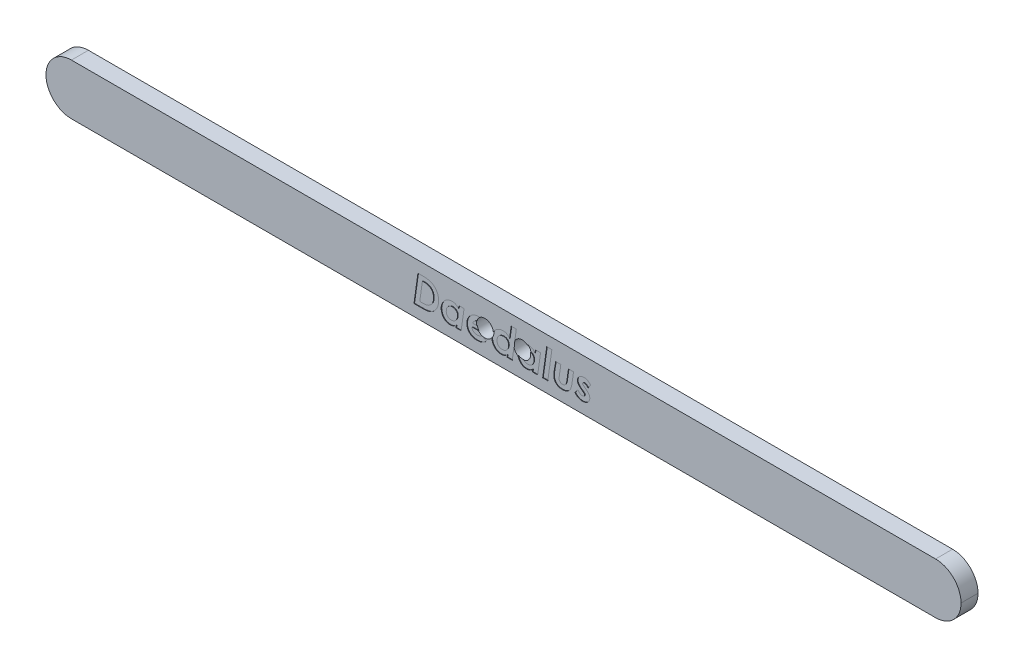
from build123d import *

# Parameters (mm, degrees)
SKETCH1_W           = 161.8
SKETCH1_H           = 9
SKETCH1_R           = 1.5
BOSS_EXTRUDE1_DEPTH = 1.5
FILLET1_R           = 4.5
CUT_EXTRUDE1_DEPTH  = 0.1


with BuildPart() as part:
    # Sketch1 → Boss-Extrude1 (new, symmetric)
    with BuildSketch(Plane.XY):
        Rectangle(SKETCH1_W, SKETCH1_H)
        with Locations((-3.3, 0)):
            Circle(SKETCH1_R, mode=Mode.SUBTRACT)
        with Locations(Location((3.3, 0, 0), (0, 0, 180))):
            Circle(SKETCH1_R, mode=Mode.SUBTRACT)
    extrude(amount=BOSS_EXTRUDE1_DEPTH, both=True)

    # Fillet1
    fillet1_edges = [part.edges().sort_by_distance(p)[0] for p in [
        (80.9, -4.5, 0),
        (80.9, 4.5, 0),
        (-80.9, -4.5, 0),
        (-80.9, 4.5, 0),
    ]]
    fillet(fillet1_edges, radius=FILLET1_R - 0.0001)  # a hair under: the kernel refuses the full size

    # Sketch2 → Cut-Extrude1 (cut)
    # profile 1 of 8: a face of its own
    with BuildSketch(Plane.XY.offset(1.5)):
        with BuildLine():
            Line((-15.132211538, 2.5), (-14.342948718, 2.5))
            add(Edge.make_bspline(
                [(-14.342948718, 2.5), (-14.253459703, 2.499260899), (-14.080405324, 2.497831622), (-13.829446112, 2.486046872), (-13.596534155, 2.465246392), (-13.381243274, 2.436457082), (-13.183555966, 2.399727039), (-13.00339673, 2.355251586), (-12.840586005, 2.302635693), (-12.69467012, 2.239416273), (-12.560316176, 2.168474984), (-12.434408081, 2.087527549), (-12.314777268, 1.997584917), (-12.200617001, 1.89921619), (-12.094241349, 1.79026066), (-11.994153323, 1.671866772), (-11.899969816, 1.54429118), (-11.812008566, 1.408858301), (-11.732886621, 1.265663392), (-11.663767497, 1.115996293), (-11.604424469, 0.961276403), (-11.557487483, 0.800654395), (-11.520382392, 0.635041016), (-11.493409213, 0.463790659), (-11.476943855, 0.287117962), (-11.475227546, 0.167637096), (-11.474358974, 0.107171474)],
                knots=[0, 0, 0, 0, 1.508928034, 2.917973822, 4.235011166, 5.450779055, 6.579221784, 7.623755204, 8.577985451, 9.460610614, 10.301756591, 11.137250569, 11.981705789, 12.823774396, 13.675702816, 14.546470419, 15.435981066, 16.347923198, 17.267651715, 18.192054867, 19.125737078, 20.059147693, 21.011116727, 21.985721956, 22.980635317, 24, 24, 24, 24], degree=3))
            add(Edge.make_bspline(
                [(-11.474358974, 0.107171474), (-11.475579373, 0.04470079), (-11.478005087, -0.07946842), (-11.495410635, -0.263471559), (-11.523558898, -0.443748401), (-11.562358309, -0.620236295), (-11.613458443, -0.793005638), (-11.677262522, -0.961146142), (-11.749912201, -1.126339576), (-11.835284961, -1.285188602), (-11.927354124, -1.437708133), (-12.027035546, -1.580319884), (-12.131585006, -1.712869937), (-12.243631401, -1.833539853), (-12.361022479, -1.944049229), (-12.483801828, -2.044395516), (-12.613293975, -2.133186768), (-12.749353262, -2.212000435), (-12.895602059, -2.281087037), (-13.054279277, -2.339613328), (-13.225872584, -2.389915389), (-13.411203285, -2.429184853), (-13.609387289, -2.461242637), (-13.820989781, -2.484203839), (-14.045986679, -2.496773686), (-14.200372164, -2.498903566), (-14.279847756, -2.5)],
                knots=[0, 0, 0, 0, 1.035326767, 2.057856534, 3.060426681, 4.057975219, 5.050723532, 6.043595218, 7.036960241, 8.039530388, 9.030318104, 9.988216712, 10.921569661, 11.826132526, 12.714780289, 13.59198308, 14.451536877, 15.31430869, 16.195534129, 17.128821459, 18.114698389, 19.15667332, 20.266554844, 21.441073174, 22.682698532, 24, 24, 24, 24], degree=3))
            Line((-14.279847756, -2.5), (-15.833333333, -2.5))
            Line((-15.833333333, -2.5), (-15.132211538, 2.5))
        make_face()
        with BuildLine():
            Line((-14.34395032, 1.666666667), (-14.810697115, -1.666666667))
            Line((-14.810697115, -1.666666667), (-14.487179487, -1.666666667))
            add(Edge.make_bspline(
                [(-14.487179487, -1.666666667), (-14.427074968, -1.666358826), (-14.311507954, -1.66576692), (-14.144567751, -1.659140543), (-13.990460972, -1.651252045), (-13.849267321, -1.636604127), (-13.720470889, -1.620304964), (-13.604946594, -1.599070086), (-13.501365712, -1.576245463), (-13.438346374, -1.554693974), (-13.408453526, -1.544471154)],
                knots=[0, 0, 0, 0, 1.323091274, 2.54399687, 3.677836413, 4.719289959, 5.668358043, 6.534823038, 7.305002022, 8, 8, 8, 8], degree=3))
            add(Edge.make_bspline(
                [(-13.408453526, -1.544471154), (-13.370044653, -1.529542925), (-13.293741889, -1.499886622), (-13.186133922, -1.442199236), (-13.081727082, -1.38105745), (-12.985086858, -1.309140371), (-12.892787597, -1.231072676), (-12.808521721, -1.143518991), (-12.728198298, -1.049699568), (-12.654664119, -0.947807371), (-12.587439513, -0.839476693), (-12.530191285, -0.723860236), (-12.480758845, -0.602494259), (-12.441176063, -0.474375796), (-12.409813209, -0.340516406), (-12.388386646, -0.200518651), (-12.3734275, -0.054410579), (-12.37234558, 0.045366383), (-12.371794872, 0.096153846)],
                knots=[0, 0, 0, 0, 0.952655881, 1.892538673, 2.821337892, 3.750040712, 4.676008024, 5.615700279, 6.558436491, 7.532008524, 8.520486916, 9.505184105, 10.513747313, 11.549809891, 12.604882282, 13.692134403, 14.825273528, 16, 16, 16, 16], degree=3))
            add(Edge.make_bspline(
                [(-12.371794872, 0.096153846), (-12.372370359, 0.137900698), (-12.373495115, 0.219492579), (-12.382333069, 0.339293599), (-12.398713988, 0.453920312), (-12.420153454, 0.563436789), (-12.448648219, 0.667747357), (-12.482603237, 0.766830211), (-12.522159958, 0.861402764), (-12.585467551, 0.97805679), (-12.675707428, 1.11415564), (-12.807528946, 1.258007833), (-12.960716342, 1.380895965), (-13.103502704, 1.466774323), (-13.228113802, 1.525536742), (-13.330452828, 1.563163623), (-13.440175284, 1.595463523), (-13.557471078, 1.620757709), (-13.681649068, 1.642489661), (-13.813558207, 1.655519724), (-13.952848284, 1.665170987), (-14.048458675, 1.666159203), (-14.09755609, 1.666666667)],
                knots=[0, 0, 0, 0, 0.941373656, 1.839862062, 2.706559874, 3.551131217, 4.354742518, 5.142827075, 5.911946928, 6.663057697, 8.133107042, 9.582556681, 11.0440985, 12.547036792, 13.328439944, 14.147940985, 15.003216405, 15.905576335, 16.852443473, 17.844335315, 18.893032825, 20, 20, 20, 20], degree=3))
            Line((-14.09755609, 1.666666667), (-14.34395032, 1.666666667))
        make_face(mode=Mode.SUBTRACT)
    # profile 2 of 8: a face of its own
    with BuildSketch(Plane.XY.offset(1.5)):
        with BuildLine():
            Line((-7.878605769, 1.153846154), (-6.973157051, 1.153846154))
            Line((-6.973157051, 1.153846154), (-7.491987179, -2.5))
            Line((-7.491987179, -2.5), (-8.397435897, -2.5))
            Line((-8.397435897, -2.5), (-8.334334936, -2.053285256))
            add(Edge.make_bspline(
                [(-8.334334936, -2.053285256), (-8.381415838, -2.098099875), (-8.471190767, -2.183553404), (-8.610236183, -2.294415261), (-8.74408368, -2.384576939), (-8.876042222, -2.453729781), (-9.009736341, -2.503901285), (-9.148511252, -2.53865166), (-9.295188761, -2.560385143), (-9.395621825, -2.562842592), (-9.447115385, -2.564102564)],
                knots=[0, 0, 0, 0, 1.236324186, 2.357450916, 3.379388742, 4.30284698, 5.185433758, 6.089881904, 7.020653398, 8, 8, 8, 8], degree=3))
            add(Edge.make_bspline(
                [(-9.447115385, -2.564102564), (-9.505973702, -2.562731379), (-9.621244612, -2.560045985), (-9.789393053, -2.534059244), (-9.948353259, -2.493416538), (-10.098200088, -2.436068437), (-10.238123866, -2.361212871), (-10.369464217, -2.270469996), (-10.491033444, -2.162722756), (-10.601164275, -2.03939637), (-10.700485446, -1.90647408), (-10.786874837, -1.766014074), (-10.861888361, -1.621302683), (-10.920274796, -1.469696183), (-10.968472226, -1.314029919), (-11.000737384, -1.152227764), (-11.021550754, -0.985451427), (-11.024267051, -0.872459036), (-11.025641026, -0.815304487)],
                knots=[0, 0, 0, 0, 1.072254913, 2.099954687, 3.093402483, 4.05863531, 5.017013142, 5.979305845, 6.962352722, 7.970695896, 8.988290287, 9.983079422, 10.973839091, 11.95483031, 12.940586347, 13.940815436, 14.958409826, 16, 16, 16, 16], degree=3))
            add(Edge.make_bspline(
                [(-11.025641026, -0.815304487), (-11.024951617, -0.77120185), (-11.023580174, -0.683468194), (-11.010034849, -0.55260336), (-10.98796442, -0.423520569), (-10.957652491, -0.295791476), (-10.919869038, -0.169451101), (-10.872637128, -0.044953503), (-10.815981169, 0.077450636), (-10.752297232, 0.197907838), (-10.682003722, 0.314965279), (-10.603150144, 0.424833864), (-10.520375244, 0.529521515), (-10.431023898, 0.62697559), (-10.335321296, 0.716877947), (-10.235240252, 0.802063497), (-10.127558111, 0.878405221), (-10.016066691, 0.949890355), (-9.900118377, 1.012134296), (-9.782855459, 1.068069389), (-9.66337217, 1.113668088), (-9.543175299, 1.152267671), (-9.421217092, 1.181254144), (-9.298093038, 1.202089726), (-9.173658416, 1.215917174), (-9.090247309, 1.217270842), (-9.048477564, 1.217948718)],
                knots=[0, 0, 0, 0, 1.010861959, 2.01091412, 3.012605424, 4.011485121, 5.018863341, 6.033918867, 7.061452407, 8.109228878, 9.15680961, 10.18900835, 11.207521355, 12.215190347, 13.216881651, 14.216552911, 15.225616441, 16.240671966, 17.251099115, 18.240697123, 19.217272556, 20.180771028, 21.133199006, 22.08832996, 23.042693801, 24, 24, 24, 24], degree=3))
            add(Edge.make_bspline(
                [(-9.048477564, 1.217948718), (-8.992929124, 1.216366129), (-8.883435176, 1.213246619), (-8.723065274, 1.18400359), (-8.569433909, 1.137752478), (-8.422921369, 1.073614092), (-8.285328222, 0.9918876), (-8.160672424, 0.891217475), (-8.046137344, 0.775826328), (-7.983531545, 0.686440727), (-7.951722756, 0.641025641)],
                knots=[0, 0, 0, 0, 1.030509072, 2.031281277, 3.015697838, 4.003854478, 4.993584726, 5.977161716, 6.972235198, 8, 8, 8, 8], degree=3))
            Line((-7.951722756, 0.641025641), (-7.878605769, 1.153846154))
        make_face()
        with BuildLine():
            add(Edge.make_bspline(
                [(-9.245793269, -1.730769231), (-9.193580803, -1.729155419), (-9.091756751, -1.726008184), (-8.944648266, -1.698128781), (-8.807563629, -1.654225901), (-8.68070998, -1.591466638), (-8.563651074, -1.508925182), (-8.45739567, -1.405907235), (-8.361424599, -1.282498916), (-8.277259601, -1.142418279), (-8.206920402, -0.991762781), (-8.155384006, -0.836227789), (-8.12251786, -0.67879862), (-8.118827894, -0.572738911), (-8.116987179, -0.519831731)],
                knots=[0, 0, 0, 0, 1.017901168, 1.985097214, 2.910041334, 3.818973104, 4.735274743, 5.693545178, 6.695670165, 7.777101795, 8.875856117, 9.932619244, 10.968700869, 12, 12, 12, 12], degree=3))
            add(Edge.make_bspline(
                [(-8.116987179, -0.519831731), (-8.11782923, -0.486751761), (-8.119484043, -0.42174235), (-8.130301118, -0.326809544), (-8.149316834, -0.23687996), (-8.176601108, -0.152009155), (-8.211452669, -0.072105856), (-8.254129812, 0.003064183), (-8.304023143, 0.072974625), (-8.361371663, 0.137565757), (-8.425458794, 0.194790813), (-8.493408957, 0.24725329), (-8.568381102, 0.288449377), (-8.64674111, 0.324397964), (-8.730630305, 0.35091484), (-8.818907013, 0.371575579), (-8.91267431, 0.382076956), (-8.976674857, 0.383756298), (-9.009415064, 0.384615385)],
                knots=[0, 0, 0, 0, 1.109141645, 2.179707075, 3.198451464, 4.18615572, 5.163657463, 6.116161664, 7.079133258, 8.038519567, 9.005387219, 9.956904198, 10.909408399, 11.866440704, 12.843493655, 13.853714903, 14.902043453, 16, 16, 16, 16], degree=3))
            add(Edge.make_bspline(
                [(-9.009415064, 0.384615385), (-9.047541065, 0.383783167), (-9.122806736, 0.38214026), (-9.233408736, 0.365172202), (-9.340084671, 0.339836808), (-9.441801701, 0.301923535), (-9.539621125, 0.255194625), (-9.63202192, 0.196155773), (-9.720800564, 0.127745963), (-9.804072167, 0.049315722), (-9.880026246, -0.037465014), (-9.946502294, -0.131083234), (-10.003072684, -0.231005098), (-10.049168089, -0.337074358), (-10.084067951, -0.449745574), (-10.110327926, -0.567562826), (-10.125452506, -0.692047524), (-10.127272813, -0.776869064), (-10.128205128, -0.8203125)],
                knots=[0, 0, 0, 0, 0.994897251, 1.964056203, 2.915642991, 3.853470011, 4.79324038, 5.741466074, 6.711095529, 7.716481674, 8.723680824, 9.71796663, 10.70964959, 11.717112863, 12.731868792, 13.785363818, 14.865719672, 16, 16, 16, 16], degree=3))
            add(Edge.make_bspline(
                [(-10.128205128, -0.8203125), (-10.127348049, -0.853721252), (-10.12567196, -0.91905484), (-10.115132283, -1.014793869), (-10.094607313, -1.10513203), (-10.067655496, -1.190657672), (-10.033655058, -1.271453156), (-9.991306599, -1.347024554), (-9.940887793, -1.417512975), (-9.883124763, -1.482345487), (-9.8188038, -1.540061601), (-9.750640812, -1.591921609), (-9.677173039, -1.634859669), (-9.599403324, -1.670365958), (-9.51704686, -1.697346912), (-9.430395578, -1.715963336), (-9.339649686, -1.72869623), (-9.277556177, -1.730067685), (-9.245793269, -1.730769231)],
                knots=[0, 0, 0, 0, 1.124431694, 2.198919568, 3.234766021, 4.236791382, 5.213425507, 6.179206721, 7.145706547, 8.12447102, 9.094881178, 10.04988442, 11.001776355, 11.952075609, 12.922030374, 13.911569148, 14.931697721, 16, 16, 16, 16], degree=3))
        make_face(mode=Mode.SUBTRACT)
    # profile 3 of 8: a face of its own
    with BuildSketch(Plane.XY.offset(1.5)):
        with BuildLine():
            Line((-3.790064103, -1.419270833), (-3.005809295, -1.821915064))
            add(Edge.make_bspline(
                [(-3.005809295, -1.821915064), (-3.052139922, -1.877348437), (-3.145264712, -1.988769794), (-3.312675296, -2.133179401), (-3.499976595, -2.261188383), (-3.707823118, -2.36943667), (-3.932287815, -2.45711626), (-4.170796644, -2.518144054), (-4.420728211, -2.55814223), (-4.591521504, -2.562091623), (-4.678485577, -2.564102564)],
                knots=[0, 0, 0, 0, 0.914244933, 1.837636877, 2.790537697, 3.784087733, 4.800790172, 5.83726639, 6.89878507, 8, 8, 8, 8], degree=3))
            add(Edge.make_bspline(
                [(-4.678485577, -2.564102564), (-4.746331478, -2.562949414), (-4.878396578, -2.560704754), (-5.070922779, -2.537673201), (-5.252860004, -2.50260413), (-5.423283571, -2.451031885), (-5.583645624, -2.387150615), (-5.731967784, -2.306795993), (-5.869215334, -2.211588059), (-5.995400844, -2.104114865), (-6.107526841, -1.983240372), (-6.206384984, -1.853172626), (-6.288783854, -1.712255264), (-6.35753675, -1.562896486), (-6.409182105, -1.402989112), (-6.447619339, -1.234502848), (-6.469470696, -1.055925868), (-6.472703578, -0.933885138), (-6.474358974, -0.871394231)],
                knots=[0, 0, 0, 0, 1.167516698, 2.272623801, 3.333371772, 4.353538571, 5.333382306, 6.300396664, 7.250661637, 8.204535574, 9.148031545, 10.083792083, 11.011414416, 11.952824574, 12.908912643, 13.898953575, 14.92416002, 16, 16, 16, 16], degree=3))
            add(Edge.make_bspline(
                [(-6.474358974, -0.871394231), (-6.472877563, -0.799503975), (-6.469964011, -0.658114494), (-6.439518793, -0.450929636), (-6.392620781, -0.25194696), (-6.326888183, -0.061278878), (-6.240192229, 0.120222198), (-6.13740066, 0.294660439), (-6.013036432, 0.458908663), (-5.872496662, 0.613386384), (-5.718877787, 0.754112078), (-5.55599507, 0.878499808), (-5.384397767, 0.983365377), (-5.205353966, 1.069635675), (-5.018018842, 1.13663509), (-4.822823631, 1.182920344), (-4.620021095, 1.213496488), (-4.48195038, 1.216452428), (-4.412059295, 1.217948718)],
                knots=[0, 0, 0, 0, 1.05529311, 2.075487762, 3.068699193, 4.055083011, 5.031283693, 6.018666653, 7.023995929, 8.051577733, 9.082465902, 10.079966066, 11.057287041, 12.031169187, 12.994424047, 13.973330935, 14.974104677, 16, 16, 16, 16], degree=3))
            add(Edge.make_bspline(
                [(-4.412059295, 1.217948718), (-4.369645021, 1.217007356), (-4.286037245, 1.215151727), (-4.162151395, 1.205577263), (-4.042269919, 1.18689755), (-3.925537908, 1.163631962), (-3.812920483, 1.131076977), (-3.703800964, 1.091674886), (-3.597053048, 1.047318936), (-3.495319517, 0.993461177), (-3.396762024, 0.935233182), (-3.304552835, 0.86806363), (-3.216327007, 0.796501348), (-3.133623529, 0.718085454), (-3.057713204, 0.632385636), (-2.986042889, 0.540996598), (-2.920314323, 0.442612239), (-2.859201771, 0.339211148), (-2.805703585, 0.230675874), (-2.757031439, 0.120563622), (-2.718496549, 0.00691664), (-2.684507283, -0.108066095), (-2.660554725, -0.22653026), (-2.640333436, -0.346620675), (-2.631129217, -0.469275083), (-2.629184179, -0.551540005), (-2.628205128, -0.592948718)],
                knots=[0, 0, 0, 0, 1.072343926, 2.113823519, 3.137889586, 4.13760148, 5.120645553, 6.097657508, 7.069516392, 8.039614793, 9.005002879, 9.960565349, 10.920144366, 11.87525951, 12.837543921, 13.811635494, 14.808779264, 15.826321551, 16.845367656, 17.865985152, 18.866871901, 19.876579391, 20.894541571, 21.919893521, 22.952961626, 24, 24, 24, 24], degree=3))
            add(Edge.make_bspline(
                [(-2.628205128, -0.592948718), (-2.628633242, -0.62033439), (-2.629521725, -0.677169038), (-2.635768229, -0.766092267), (-2.6469331, -0.861599069), (-2.657041642, -0.927513695), (-2.662259615, -0.961538462)],
                knots=[0, 0, 0, 0, 0.886860648, 1.840539587, 2.885298471, 4, 4, 4, 4], degree=3))
            Line((-2.662259615, -0.961538462), (-5.576923077, -0.961538462))
            add(Edge.make_bspline(
                [(-5.576923077, -0.961538462), (-5.575010525, -0.990288475), (-5.571279578, -1.04637312), (-5.558684062, -1.128102851), (-5.53726639, -1.204847297), (-5.509013094, -1.277128362), (-5.474914628, -1.345774486), (-5.433958385, -1.410474241), (-5.384376332, -1.46924642), (-5.328998157, -1.52392849), (-5.267270839, -1.572773278), (-5.199463962, -1.614787864), (-5.126782718, -1.651761688), (-5.047428591, -1.679923947), (-4.963188738, -1.703442347), (-4.87324351, -1.718909333), (-4.777897764, -1.729474607), (-4.712237553, -1.730329686), (-4.678485577, -1.730769231)],
                knots=[0, 0, 0, 0, 1.040300458, 2.029386266, 2.980027991, 3.911437883, 4.828060054, 5.744444316, 6.66911896, 7.598419554, 8.551199615, 9.504589747, 10.47513087, 11.489753162, 12.539789264, 13.630032591, 14.781741895, 16, 16, 16, 16], degree=3))
            add(Edge.make_bspline(
                [(-4.678485577, -1.730769231), (-4.637389215, -1.72970156), (-4.555960211, -1.72758606), (-4.435453239, -1.713907415), (-4.318738192, -1.688177417), (-4.205514399, -1.6541973), (-4.095344042, -1.611483316), (-3.990249576, -1.556271919), (-3.887123247, -1.493590211), (-3.822692727, -1.444254971), (-3.790064103, -1.419270833)],
                knots=[0, 0, 0, 0, 1.027214308, 2.035339218, 3.025519259, 4.010199041, 4.987959988, 5.973205312, 6.973599434, 8, 8, 8, 8], degree=3))
        make_face()
        with BuildLine():
            add(Edge.make_bspline(
                [(-3.58974359, -0.320512821), (-3.607553688, -0.265483301), (-3.641847315, -0.159523087), (-3.71665339, -0.015678251), (-3.807968832, 0.107225043), (-3.915905947, 0.208304681), (-4.038397997, 0.287025151), (-4.173110745, 0.343960258), (-4.32013815, 0.379032421), (-4.422544347, 0.382720476), (-4.475160256, 0.384615385)],
                knots=[0, 0, 0, 0, 1.131480038, 2.178682812, 3.159669316, 4.117470342, 5.058967564, 5.99670948, 6.970717055, 8, 8, 8, 8], degree=3))
            add(Edge.make_bspline(
                [(-4.475160256, 0.384615385), (-4.527798409, 0.382766807), (-4.631626747, 0.379120503), (-4.782478398, 0.341968378), (-4.926186127, 0.28474051), (-5.059641679, 0.202874565), (-5.183165812, 0.101925427), (-5.289188569, -0.021394177), (-5.382625971, -0.161728222), (-5.428260646, -0.266596829), (-5.451722756, -0.320512821)],
                knots=[0, 0, 0, 0, 0.983432494, 1.939812791, 2.890131691, 3.868528921, 4.858194814, 5.863362488, 6.901492691, 8, 8, 8, 8], degree=3))
            Line((-5.451722756, -0.320512821), (-3.58974359, -0.320512821))
        make_face(mode=Mode.SUBTRACT)
    # profile 4 of 8: a face of its own
    with BuildSketch(Plane.XY.offset(1.5)):
        with BuildLine():
            Line((1.360176282, 2.628205128), (2.264623397, 2.628205128))
            Line((2.264623397, 2.628205128), (1.545472756, -2.5))
            Line((1.545472756, -2.5), (0.641025641, -2.5))
            Line((0.641025641, -2.5), (0.703125, -2.061298077))
            add(Edge.make_bspline(
                [(0.703125, -2.061298077), (0.654556226, -2.104955201), (0.56172909, -2.18839494), (0.420587843, -2.29881686), (0.283027658, -2.386698012), (0.148107492, -2.454581448), (0.011820288, -2.505246561), (-0.130599678, -2.538409116), (-0.280432552, -2.560407984), (-0.38319805, -2.562853329), (-0.435697115, -2.564102564)],
                knots=[0, 0, 0, 0, 1.224191978, 2.339738612, 3.35557837, 4.279346016, 5.166550601, 6.074424882, 7.016295399, 8, 8, 8, 8], degree=3))
            add(Edge.make_bspline(
                [(-0.435697115, -2.564102564), (-0.495886379, -2.562720833), (-0.613806306, -2.560013812), (-0.785648881, -2.534200833), (-0.948170617, -2.493236689), (-1.101705371, -2.436099893), (-1.245428059, -2.361483941), (-1.379957972, -2.270861761), (-1.503536083, -2.162416324), (-1.616912352, -2.039883171), (-1.71775066, -1.906111065), (-1.807889547, -1.766697546), (-1.883103596, -1.621021291), (-1.944231596, -1.470000838), (-1.992939339, -1.314026097), (-2.026677138, -1.152358943), (-2.04711235, -0.985434982), (-2.049881395, -0.872453512), (-2.051282051, -0.815304487)],
                knots=[0, 0, 0, 0, 1.084756537, 2.125203127, 3.125436952, 4.102778343, 5.072150728, 6.038977154, 7.020481913, 8.030147435, 9.044022342, 10.037711967, 11.020545278, 11.995435886, 12.972332138, 13.96300789, 14.969635358, 16, 16, 16, 16], degree=3))
            add(Edge.make_bspline(
                [(-2.051282051, -0.815304487), (-2.050598323, -0.77120064), (-2.049238179, -0.683464577), (-2.035608756, -0.552617656), (-2.013844435, -0.423389971), (-1.982288725, -0.295746209), (-1.943228078, -0.169655503), (-1.896551205, -0.044678982), (-1.838419582, 0.077376448), (-1.774201554, 0.198313272), (-1.701268595, 0.314311737), (-1.62300679, 0.425519841), (-1.537888388, 0.529522104), (-1.446649321, 0.62667943), (-1.349894703, 0.717240594), (-1.247772256, 0.802036151), (-1.138164689, 0.87844225), (-1.024630462, 0.949869001), (-0.906507356, 1.012434495), (-0.786654769, 1.067834892), (-0.664975092, 1.113716126), (-0.542752103, 1.152266182), (-0.418801591, 1.18125808), (-0.293677167, 1.202090528), (-0.16691093, 1.215953656), (-0.081833795, 1.217281276), (-0.0390625, 1.217948718)],
                knots=[0, 0, 0, 0, 1.001967791, 1.993220895, 2.986098719, 3.977961405, 4.97869321, 5.984817669, 7.006498751, 8.048625242, 9.094941425, 10.118058263, 11.137144237, 12.14626801, 13.144667405, 14.147209555, 15.159750235, 16.178723228, 17.193620539, 18.195157345, 19.177309233, 20.146807454, 21.105618391, 22.067306845, 23.028366579, 24, 24, 24, 24], degree=3))
            add(Edge.make_bspline(
                [(-0.0390625, 1.217948718), (0.017492894, 1.216022482), (0.129026774, 1.21222372), (0.292481541, 1.182089448), (0.449237081, 1.134246268), (0.59764011, 1.065414642), (0.737501765, 0.979448064), (0.865456491, 0.874668411), (0.980231729, 0.751117176), (1.044160596, 0.657605912), (1.076722756, 0.609975962)],
                knots=[0, 0, 0, 0, 1.021752344, 2.015015653, 2.994318812, 3.977315891, 4.96380846, 5.954501398, 6.958125541, 8, 8, 8, 8], degree=3))
            Line((1.076722756, 0.609975962), (1.360176282, 2.628205128))
        make_face()
        with BuildLine():
            add(Edge.make_bspline(
                [(-0.244391026, -1.730769231), (-0.190846214, -1.72915371), (-0.086376914, -1.726001726), (0.064697332, -1.698116118), (0.205761468, -1.654261656), (0.336549612, -1.591507566), (0.457597605, -1.509379663), (0.566933461, -1.406009125), (0.666065089, -1.282706353), (0.752986466, -1.142492848), (0.826876884, -0.992284889), (0.878855295, -0.836224154), (0.913222815, -0.678923127), (0.916724065, -0.572758327), (0.918469551, -0.519831731)],
                knots=[0, 0, 0, 0, 1.029364739, 2.008355467, 2.944869541, 3.864220442, 4.788874237, 5.747766117, 6.747937481, 7.824404024, 8.916094465, 9.960164733, 10.983075963, 12, 12, 12, 12], degree=3))
            add(Edge.make_bspline(
                [(0.918469551, -0.519831731), (0.917710914, -0.486745438), (0.916219103, -0.421683471), (0.90420435, -0.326729346), (0.883834649, -0.237042827), (0.857134837, -0.151751639), (0.820855512, -0.072121469), (0.777399454, 0.003406696), (0.725311858, 0.073004546), (0.666027817, 0.137622527), (0.599943584, 0.194831821), (0.529967878, 0.24729667), (0.453010915, 0.288444486), (0.372383456, 0.324609377), (0.285748095, 0.350884927), (0.194810559, 0.371478221), (0.098408922, 0.382129094), (0.032741069, 0.383771469), (-0.001001603, 0.384615385)],
                knots=[0, 0, 0, 0, 1.092929283, 2.14917182, 3.155385987, 4.128652935, 5.096340581, 6.040415546, 7.002301806, 7.962478832, 8.931674171, 9.887023602, 10.844853392, 11.808066958, 12.802359889, 13.83011003, 14.885026967, 16, 16, 16, 16], degree=3))
            add(Edge.make_bspline(
                [(-0.001001603, 0.384615385), (-0.040462311, 0.383796818), (-0.118054372, 0.382187262), (-0.231980061, 0.365171177), (-0.341639049, 0.339844497), (-0.446354862, 0.301942059), (-0.547175708, 0.255251452), (-0.642537741, 0.19616593), (-0.734353176, 0.128172852), (-0.819590439, 0.048997156), (-0.8986152, -0.037079367), (-0.967119585, -0.130802623), (-1.024767314, -0.230948304), (-1.071417573, -0.337245352), (-1.109362127, -0.449341526), (-1.13446276, -0.567700219), (-1.151491808, -0.69194691), (-1.153048995, -0.776849134), (-1.153846154, -0.8203125)],
                knots=[0, 0, 0, 0, 1.015017545, 1.99584108, 2.958882485, 3.907551637, 4.857154596, 5.813732046, 6.790026937, 7.79362874, 8.803576363, 9.793693459, 10.775457832, 11.771969563, 12.777519716, 13.815952619, 14.881936806, 16, 16, 16, 16], degree=3))
            add(Edge.make_bspline(
                [(-1.153846154, -0.8203125), (-1.15311607, -0.853738148), (-1.151687453, -0.919144916), (-1.139358344, -1.014686843), (-1.119603023, -1.105337624), (-1.091120757, -1.190637372), (-1.056512933, -1.271826088), (-1.011686399, -1.346727838), (-0.960589459, -1.417906901), (-0.900631183, -1.482348846), (-0.834414761, -1.540127861), (-0.764190746, -1.591919566), (-0.688540156, -1.635159195), (-0.608204244, -1.670133329), (-0.52364783, -1.697380168), (-0.4346633, -1.716052038), (-0.341238478, -1.728678346), (-0.27715347, -1.730061907), (-0.244391026, -1.730769231)],
                knots=[0, 0, 0, 0, 1.107979885, 2.168077127, 3.188767881, 4.179540202, 5.146268969, 6.108932095, 7.067768028, 8.04709314, 9.01982551, 9.978661443, 10.935770145, 11.902498912, 12.87931775, 13.876010336, 14.914143953, 16, 16, 16, 16], degree=3))
        make_face(mode=Mode.SUBTRACT)
    # profile 5 of 8: a face of its own
    with BuildSketch(Plane.XY.offset(1.5)):
        with BuildLine():
            Line((5.647035256, 1.153846154), (6.552483974, 1.153846154))
            Line((6.552483974, 1.153846154), (6.033653846, -2.5))
            Line((6.033653846, -2.5), (5.128205128, -2.5))
            Line((5.128205128, -2.5), (5.19130609, -2.053285256))
            add(Edge.make_bspline(
                [(5.19130609, -2.053285256), (5.144225188, -2.098099875), (5.054450259, -2.183553404), (4.915404842, -2.294415261), (4.781557346, -2.384576939), (4.649598804, -2.453729781), (4.515904684, -2.503901285), (4.377129774, -2.53865166), (4.230452265, -2.560385143), (4.130019201, -2.562842592), (4.078525641, -2.564102564)],
                knots=[0, 0, 0, 0, 1.236324186, 2.357450916, 3.379388742, 4.30284698, 5.185433758, 6.089881904, 7.020653398, 8, 8, 8, 8], degree=3))
            add(Edge.make_bspline(
                [(4.078525641, -2.564102564), (4.019667324, -2.562731379), (3.904396413, -2.560045985), (3.736247973, -2.534059244), (3.577287766, -2.493416538), (3.427440938, -2.436068437), (3.28751716, -2.361212871), (3.156176809, -2.270469996), (3.034607581, -2.162722756), (2.92447675, -2.03939637), (2.825155579, -1.90647408), (2.738766189, -1.766014074), (2.663752664, -1.621302683), (2.60536623, -1.469696183), (2.5571688, -1.314029919), (2.524903641, -1.152227764), (2.504090272, -0.985451427), (2.501373975, -0.872459036), (2.5, -0.815304487)],
                knots=[0, 0, 0, 0, 1.072254913, 2.099954687, 3.093402483, 4.05863531, 5.017013142, 5.979305845, 6.962352722, 7.970695896, 8.988290287, 9.983079422, 10.973839091, 11.95483031, 12.940586347, 13.940815436, 14.958409826, 16, 16, 16, 16], degree=3))
            add(Edge.make_bspline(
                [(2.5, -0.815304487), (2.500689408, -0.77120185), (2.502060852, -0.683468194), (2.515606177, -0.55260336), (2.537676606, -0.423520569), (2.567988535, -0.295791476), (2.605771988, -0.169451101), (2.653003898, -0.044953503), (2.709659856, 0.077450636), (2.773343794, 0.197907838), (2.843637303, 0.314965279), (2.922490882, 0.424833864), (3.005265782, 0.529521515), (3.094617127, 0.62697559), (3.19031973, 0.716877947), (3.290400774, 0.802063497), (3.398082915, 0.878405221), (3.509574334, 0.949890355), (3.625522648, 1.012134296), (3.742785566, 1.068069389), (3.862268856, 1.113668088), (3.982465727, 1.152267671), (4.104423933, 1.181254144), (4.227547987, 1.202089726), (4.35198261, 1.215917174), (4.435393717, 1.217270842), (4.477163462, 1.217948718)],
                knots=[0, 0, 0, 0, 1.010861959, 2.01091412, 3.012605424, 4.011485121, 5.018863341, 6.033918867, 7.061452407, 8.109228878, 9.15680961, 10.18900835, 11.207521355, 12.215190347, 13.216881651, 14.216552911, 15.225616441, 16.240671966, 17.251099115, 18.240697123, 19.217272556, 20.180771028, 21.133199006, 22.08832996, 23.042693801, 24, 24, 24, 24], degree=3))
            add(Edge.make_bspline(
                [(4.477163462, 1.217948718), (4.532711902, 1.216366129), (4.64220585, 1.213246619), (4.802575751, 1.18400359), (4.956207116, 1.137752478), (5.102719656, 1.073614092), (5.240312804, 0.9918876), (5.364968601, 0.891217475), (5.479503682, 0.775826328), (5.54210948, 0.686440727), (5.573918269, 0.641025641)],
                knots=[0, 0, 0, 0, 1.030509072, 2.031281277, 3.015697838, 4.003854478, 4.993584726, 5.977161716, 6.972235198, 8, 8, 8, 8], degree=3))
            Line((5.573918269, 0.641025641), (5.647035256, 1.153846154))
        make_face()
        with BuildLine():
            add(Edge.make_bspline(
                [(4.279847756, -1.730769231), (4.332060223, -1.729155419), (4.433884275, -1.726008184), (4.58099276, -1.698128781), (4.718077397, -1.654225901), (4.844931046, -1.591466638), (4.961989952, -1.508925182), (5.068245356, -1.405907235), (5.164216427, -1.282498916), (5.248381425, -1.142418279), (5.318720624, -0.991762781), (5.370257019, -0.836227789), (5.403123166, -0.67879862), (5.406813131, -0.572738911), (5.408653846, -0.519831731)],
                knots=[0, 0, 0, 0, 1.017901168, 1.985097214, 2.910041334, 3.818973104, 4.735274743, 5.693545178, 6.695670165, 7.777101795, 8.875856117, 9.932619244, 10.968700869, 12, 12, 12, 12], degree=3))
            add(Edge.make_bspline(
                [(5.408653846, -0.519831731), (5.407811796, -0.486751761), (5.406156983, -0.42174235), (5.395339908, -0.326809544), (5.376324191, -0.23687996), (5.349039918, -0.152009155), (5.314188356, -0.072105856), (5.271511214, 0.003064183), (5.221617882, 0.072974625), (5.164269363, 0.137565757), (5.100182231, 0.194790813), (5.032232068, 0.24725329), (4.957259924, 0.288449377), (4.878899916, 0.324397964), (4.795010721, 0.35091484), (4.706734013, 0.371575579), (4.612966716, 0.382076956), (4.548966169, 0.383756298), (4.516225962, 0.384615385)],
                knots=[0, 0, 0, 0, 1.109141645, 2.179707075, 3.198451464, 4.18615572, 5.163657463, 6.116161664, 7.079133258, 8.038519567, 9.005387219, 9.956904198, 10.909408399, 11.866440704, 12.843493655, 13.853714903, 14.902043453, 16, 16, 16, 16], degree=3))
            add(Edge.make_bspline(
                [(4.516225962, 0.384615385), (4.47809996, 0.383783167), (4.40283429, 0.38214026), (4.29223229, 0.365172202), (4.185556354, 0.339836808), (4.083839325, 0.301923535), (3.9860199, 0.255194625), (3.893619106, 0.196155773), (3.804840462, 0.127745963), (3.721568858, 0.049315722), (3.645614779, -0.037465014), (3.579138732, -0.131083234), (3.522568341, -0.231005098), (3.476472936, -0.337074358), (3.441573075, -0.449745574), (3.4153131, -0.567562826), (3.40018852, -0.692047524), (3.398368213, -0.776869064), (3.397435897, -0.8203125)],
                knots=[0, 0, 0, 0, 0.994897251, 1.964056203, 2.915642991, 3.853470011, 4.79324038, 5.741466074, 6.711095529, 7.716481674, 8.723680824, 9.71796663, 10.70964959, 11.717112863, 12.731868792, 13.785363818, 14.865719672, 16, 16, 16, 16], degree=3))
            add(Edge.make_bspline(
                [(3.397435897, -0.8203125), (3.398292976, -0.853721252), (3.399969065, -0.91905484), (3.410508743, -1.014793869), (3.431033713, -1.10513203), (3.45798553, -1.190657672), (3.491985967, -1.271453156), (3.534334427, -1.347024554), (3.584753233, -1.417512975), (3.642516263, -1.482345487), (3.706837225, -1.540061601), (3.775000213, -1.591921609), (3.848467986, -1.634859669), (3.926237702, -1.670365958), (4.008594165, -1.697346912), (4.095245448, -1.715963336), (4.185991339, -1.72869623), (4.248084848, -1.730067685), (4.279847756, -1.730769231)],
                knots=[0, 0, 0, 0, 1.124431694, 2.198919568, 3.234766021, 4.236791382, 5.213425507, 6.179206721, 7.145706547, 8.12447102, 9.094881178, 10.04988442, 11.001776355, 11.952075609, 12.922030374, 13.911569148, 14.931697721, 16, 16, 16, 16], degree=3))
        make_face(mode=Mode.SUBTRACT)
    # profile 6 of 8: a face of its own
    with BuildSketch(Plane.XY.offset(1.5)):
        Polygon((7.642227564, 2.628205128), (8.547676282, 2.628205128), (7.828525641, -2.5), (6.923076923, -2.5), align=None)
    # profile 7 of 8: a face of its own
    with BuildSketch(Plane.XY.offset(1.5)):
        with BuildLine():
            Line((9.229767628, 1.153846154), (10.135216346, 1.153846154))
            Line((10.135216346, 1.153846154), (9.868790064, -0.701121795))
            add(Edge.make_bspline(
                [(9.868790064, -0.701121795), (9.862607528, -0.749176833), (9.851070928, -0.838847437), (9.83755936, -0.963682217), (9.830390185, -1.069632252), (9.82855513, -1.13380714), (9.827724359, -1.162860577)],
                knots=[0, 0, 0, 0, 1.253526504, 2.339077935, 3.248062684, 4, 4, 4, 4], degree=3))
            add(Edge.make_bspline(
                [(9.827724359, -1.162860577), (9.829336827, -1.201520585), (9.832495984, -1.277263483), (9.866606326, -1.384890603), (9.91828594, -1.484022937), (9.991581731, -1.570134938), (10.080911743, -1.642231489), (10.185251263, -1.693575135), (10.301577912, -1.725890236), (10.383392574, -1.729106699), (10.42568109, -1.730769231)],
                knots=[0, 0, 0, 0, 1.002835694, 1.964761131, 2.909147679, 3.895784594, 4.884866332, 5.875587295, 6.90192956, 8, 8, 8, 8], degree=3))
            add(Edge.make_bspline(
                [(10.42568109, -1.730769231), (10.453422517, -1.730295765), (10.507430428, -1.729374006), (10.585967668, -1.719236082), (10.659356568, -1.702137111), (10.727846313, -1.679107625), (10.791626366, -1.650113035), (10.850251934, -1.613807723), (10.903270277, -1.570276093), (10.953298333, -1.520242088), (10.99743188, -1.458236618), (11.039743226, -1.385102894), (11.077075294, -1.297589481), (11.113498776, -1.19754573), (11.144631897, -1.083088963), (11.173713524, -0.955451396), (11.199565128, -0.814398052), (11.213630757, -0.715533047), (11.220953526, -0.6640625)],
                knots=[0, 0, 0, 0, 0.892108868, 1.736786517, 2.541881516, 3.312938247, 4.057891121, 4.791136306, 5.524224126, 6.261001152, 7.060198994, 7.964829526, 8.974738879, 10.116351085, 11.388184609, 12.787440625, 14.327495265, 16, 16, 16, 16], degree=3))
            Line((11.220953526, -0.6640625), (11.48036859, 1.153846154))
            Line((11.48036859, 1.153846154), (12.38681891, 1.153846154))
            Line((12.38681891, 1.153846154), (12.107371795, -0.802283654))
            add(Edge.make_bspline(
                [(12.107371795, -0.802283654), (12.099404862, -0.855430478), (12.083875685, -0.959024478), (12.054852182, -1.109403812), (12.021470755, -1.250551363), (11.986497756, -1.38309263), (11.944581553, -1.505297357), (11.901365069, -1.619294862), (11.851816392, -1.723212538), (11.783641821, -1.849197214), (11.685157655, -1.99024851), (11.549832187, -2.140769457), (11.39574178, -2.269636506), (11.2239264, -2.376235671), (11.035999467, -2.461526681), (10.831254401, -2.520777746), (10.61098176, -2.557795858), (10.45888713, -2.561959614), (10.380608974, -2.564102564)],
                knots=[0, 0, 0, 0, 0.938282912, 1.828904783, 2.673080473, 3.47068305, 4.220973376, 4.927886656, 5.59807994, 6.229421123, 7.427669869, 8.591533972, 9.754419504, 10.92230609, 12.112044702, 13.346047806, 14.63409719, 16, 16, 16, 16], degree=3))
            add(Edge.make_bspline(
                [(10.380608974, -2.564102564), (10.325132749, -2.563020966), (10.216878799, -2.56091038), (10.058773535, -2.542345659), (9.909433976, -2.513032837), (9.769209972, -2.470241032), (9.636797744, -2.417584935), (9.51382308, -2.351242459), (9.399019383, -2.273431612), (9.294705898, -2.183555038), (9.200585812, -2.08442307), (9.117841845, -1.978036894), (9.048250112, -1.864159532), (8.992019705, -1.743022173), (8.948019101, -1.615421505), (8.915613395, -1.481032296), (8.896316846, -1.339373983), (8.894272117, -1.242381419), (8.893229167, -1.192908654)],
                knots=[0, 0, 0, 0, 1.168632583, 2.280420012, 3.349725486, 4.371307417, 5.365511249, 6.347568045, 7.309587773, 8.282530155, 9.242979364, 10.185822766, 11.117310968, 12.048958566, 12.994554036, 13.956959565, 14.957911239, 16, 16, 16, 16], degree=3))
            add(Edge.make_bspline(
                [(8.893229167, -1.192908654), (8.893807205, -1.160522224), (8.894999367, -1.09372747), (8.898624131, -0.990142005), (8.907132132, -0.879975771), (8.918214091, -0.762782091), (8.931813825, -0.638790922), (8.950798641, -0.508453261), (8.969905277, -0.371315371), (8.986104375, -0.278068859), (8.994391026, -0.23036859)],
                knots=[0, 0, 0, 0, 0.80233306, 1.654755999, 2.566827454, 3.538651181, 4.570611162, 5.655930814, 6.800891005, 8, 8, 8, 8], degree=3))
            Line((8.994391026, -0.23036859), (9.229767628, 1.153846154))
        make_face()
    # profile 8 of 8: a face of its own
    with BuildSketch(Plane.XY.offset(1.5)):
        with BuildLine():
            Line((15.371594551, 0.611979167), (14.945913462, -0.075120192))
            add(Edge.make_bspline(
                [(14.945913462, -0.075120192), (14.918810709, -0.037921711), (14.866635953, 0.033688051), (14.78142508, 0.129617116), (14.69330622, 0.209156374), (14.603523256, 0.272802223), (14.51486904, 0.321667215), (14.428804846, 0.357773213), (14.345090153, 0.380188963), (14.289652359, 0.383171729), (14.262820513, 0.384615385)],
                knots=[0, 0, 0, 0, 1.293875212, 2.490803217, 3.601185646, 4.625026071, 5.578970932, 6.442087991, 7.245971894, 8, 8, 8, 8], degree=3))
            add(Edge.make_bspline(
                [(14.262820513, 0.384615385), (14.243398853, 0.383862986), (14.205497757, 0.38239469), (14.150750628, 0.370444815), (14.100934917, 0.349084514), (14.057838755, 0.320223432), (14.021103845, 0.287716738), (13.995033391, 0.251319673), (13.976851299, 0.212925233), (13.975189749, 0.185825505), (13.974358974, 0.172275641)],
                knots=[0, 0, 0, 0, 1.182476273, 2.30758579, 3.391877461, 4.463697876, 5.456992938, 6.360200449, 7.180100224, 8, 8, 8, 8], degree=3))
            add(Edge.make_bspline(
                [(13.974358974, 0.172275641), (13.975045376, 0.15912537), (13.976451532, 0.132185833), (13.991362927, 0.092782636), (14.010494626, 0.051987511), (14.030201654, 0.027681961), (14.040464744, 0.015024038)],
                knots=[0, 0, 0, 0, 0.903144459, 1.85017425, 2.880406844, 4, 4, 4, 4], degree=3))
            add(Edge.make_bspline(
                [(14.040464744, 0.015024038), (14.047014447, 0.007554169), (14.061981433, -0.009515526), (14.090811866, -0.035199344), (14.126847194, -0.066263491), (14.170699787, -0.102312519), (14.223144481, -0.141821567), (14.2820647, -0.187692613), (14.350541356, -0.236171153), (14.3987122, -0.270424198), (14.424078526, -0.288461538)],
                knots=[0, 0, 0, 0, 0.486262068, 1.111176692, 1.888157049, 2.817936484, 3.890888726, 5.104451828, 6.475230771, 8, 8, 8, 8], degree=3))
            add(Edge.make_bspline(
                [(14.424078526, -0.288461538), (14.464981905, -0.31760578), (14.543901165, -0.373836878), (14.6552157, -0.458934885), (14.755106105, -0.541137754), (14.845317613, -0.61891401), (14.922832492, -0.695496386), (14.991798324, -0.766743992), (15.048123364, -0.836543705), (15.109307686, -0.923374782), (15.167443415, -1.034516877), (15.219912743, -1.171692326), (15.250669732, -1.31541708), (15.254487154, -1.413119955), (15.256410256, -1.462339744)],
                knots=[0, 0, 0, 0, 1.202285104, 2.319697097, 3.353301761, 4.299159753, 5.169575473, 5.96111865, 6.671375532, 7.314364668, 8.50149111, 9.6623909, 10.822382393, 12, 12, 12, 12], degree=3))
            add(Edge.make_bspline(
                [(15.256410256, -1.462339744), (15.255536358, -1.495128811), (15.253786928, -1.560768184), (15.23680232, -1.65805454), (15.210941044, -1.75422117), (15.173165856, -1.848535983), (15.125994469, -1.942295169), (15.067607056, -2.03426401), (14.998754935, -2.124857678), (14.920927666, -2.213495699), (14.831966166, -2.295448526), (14.733738196, -2.368277306), (14.62491838, -2.428359595), (14.507465692, -2.479159282), (14.379360974, -2.51617668), (14.242865048, -2.544804834), (14.096575064, -2.560329549), (13.996093372, -2.562819425), (13.944310897, -2.564102564)],
                knots=[0, 0, 0, 0, 0.823882478, 1.649303646, 2.476260642, 3.324427264, 4.199309487, 5.112434692, 6.059514339, 7.058678777, 8.074738792, 9.095747378, 10.125726673, 11.194005657, 12.30701197, 13.472823075, 14.697638618, 16, 16, 16, 16], degree=3))
            add(Edge.make_bspline(
                [(13.944310897, -2.564102564), (13.884120832, -2.562397838), (13.765784132, -2.55904626), (13.592493308, -2.531810757), (13.4279334, -2.484792526), (13.296025545, -2.43222377), (13.193082303, -2.37910535), (13.114951495, -2.329976835), (13.033534323, -2.275280597), (12.950788295, -2.21179086), (12.865244793, -2.141330969), (12.777577519, -2.063632817), (12.687974242, -1.977838152), (12.628699062, -1.917240865), (12.598157051, -1.886017628)],
                knots=[0, 0, 0, 0, 1.3917013, 2.736154834, 4.044007326, 5.343168153, 6.013207005, 6.720436798, 7.476485983, 8.281134576, 9.131434638, 10.039487272, 10.989830126, 12, 12, 12, 12], degree=3))
            Line((12.598157051, -1.886017628), (13.150040064, -1.251001603))
            add(Edge.make_bspline(
                [(13.150040064, -1.251001603), (13.181188014, -1.2888922), (13.241580168, -1.36235754), (13.338557644, -1.460845883), (13.438200011, -1.543805412), (13.540255669, -1.611666618), (13.644111984, -1.665486139), (13.75109557, -1.702596725), (13.859712808, -1.727263883), (13.933494873, -1.729601486), (13.970352564, -1.730769231)],
                knots=[0, 0, 0, 0, 1.194983961, 2.316931099, 3.362897671, 4.349081709, 5.298844883, 6.204687641, 7.103155112, 8, 8, 8, 8], degree=3))
            add(Edge.make_bspline(
                [(13.970352564, -1.730769231), (13.998492736, -1.730015613), (14.052278045, -1.728575196), (14.128280171, -1.712037225), (14.195949163, -1.686420051), (14.252977069, -1.649090691), (14.299085863, -1.604965887), (14.334550088, -1.557122517), (14.354688383, -1.503200912), (14.357528522, -1.466168093), (14.358974359, -1.447315705)],
                knots=[0, 0, 0, 0, 1.262863261, 2.413755393, 3.478337955, 4.49818724, 5.453495978, 6.336264993, 7.153038342, 8, 8, 8, 8], degree=3))
            add(Edge.make_bspline(
                [(14.358974359, -1.447315705), (14.357974744, -1.431832881), (14.355909308, -1.399841765), (14.339291869, -1.352391495), (14.315496984, -1.303506536), (14.285237404, -1.263609325), (14.254293146, -1.228534394), (14.221528401, -1.197387529), (14.180448277, -1.161695971), (14.131321405, -1.12066478), (14.074022448, -1.074416619), (14.008136642, -1.023339389), (13.932767078, -0.968686144), (13.87988025, -0.930479806), (13.852163462, -0.910456731)],
                knots=[0, 0, 0, 0, 0.730705261, 1.509807026, 2.357288366, 3.29541125, 3.865889586, 4.569470673, 5.431105645, 6.440057403, 7.596752151, 8.913931468, 10.38266143, 12, 12, 12, 12], degree=3))
            add(Edge.make_bspline(
                [(13.852163462, -0.910456731), (13.819680785, -0.886885677), (13.756553417, -0.841077305), (13.666791506, -0.772591235), (13.585495718, -0.705824133), (13.510926874, -0.64323194), (13.445081999, -0.58207143), (13.386476977, -0.524045686), (13.336242799, -0.468216448), (13.307086395, -0.430523075), (13.293269231, -0.412660256)],
                knots=[0, 0, 0, 0, 1.282428707, 2.492293047, 3.606974981, 4.643787634, 5.602579517, 6.477648517, 7.278560515, 8, 8, 8, 8], degree=3))
            add(Edge.make_bspline(
                [(13.293269231, -0.412660256), (13.260356694, -0.364476429), (13.196206627, -0.270560979), (13.127489826, -0.117443575), (13.08547694, 0.040163685), (13.079771611, 0.146986466), (13.076923077, 0.200320513)],
                knots=[0, 0, 0, 0, 1.057832104, 2.061828311, 3.032317477, 4, 4, 4, 4], degree=3))
            add(Edge.make_bspline(
                [(13.076923077, 0.200320513), (13.077660812, 0.237124536), (13.079111184, 0.309480435), (13.097171578, 0.414790991), (13.123764384, 0.515135706), (13.16251197, 0.60959719), (13.210468118, 0.69999058), (13.271476711, 0.783872431), (13.34161814, 0.863721369), (13.422831899, 0.936283283), (13.511438046, 1.001081158), (13.603521762, 1.060539528), (13.70154874, 1.108005569), (13.802496093, 1.148355422), (13.907401939, 1.17971011), (14.016413067, 1.201292188), (14.129193964, 1.216237907), (14.20601354, 1.217374814), (14.244791667, 1.217948718)],
                knots=[0, 0, 0, 0, 1.021630065, 2.008502182, 2.960568009, 3.90126412, 4.839440403, 5.797185411, 6.776483436, 7.788164727, 8.816178467, 9.825218622, 10.829341502, 11.837229321, 12.844091735, 13.866690309, 14.923116238, 16, 16, 16, 16], degree=3))
            add(Edge.make_bspline(
                [(14.244791667, 1.217948718), (14.299325773, 1.215910769), (14.408160372, 1.211843601), (14.569344185, 1.182435484), (14.725676096, 1.13129747), (14.876664295, 1.062313503), (15.019993884, 0.97584661), (15.150666503, 0.870231668), (15.27051868, 0.750074609), (15.33767097, 0.658327439), (15.371594551, 0.611979167)],
                knots=[0, 0, 0, 0, 0.983198209, 1.962184592, 2.942724805, 3.942248462, 4.950006518, 5.952318655, 6.965564907, 8, 8, 8, 8], degree=3))
        make_face()
    extrude(amount=-CUT_EXTRUDE1_DEPTH, mode=Mode.SUBTRACT)


solid = part.part
